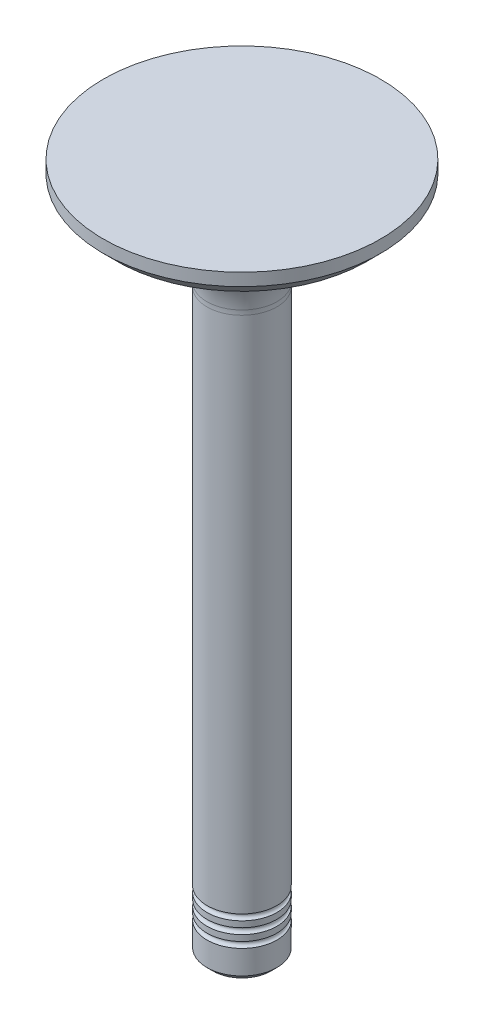
from build123d import *

# Parameters (mm, degrees)
FILLET1_R     = 10
CHAMFER1_SIZE = 1


with BuildPart() as part:
    # Sketch1 → Revolve1 (revolve)
    with BuildSketch(Plane.XY):
        with BuildLine():
            Line((0, 105.721798884), (-23.22, 105.721798884))
            Line((-23.22, 105.721798884), (-23.22, 103.621798884))
            Line((-23.22, 103.621798884), (-20.898, 101.299798884))
            ThreePointArc((-20.898, 101.299798884), (-10.516266258, 97.494211563), (-5.85, 87.469798884))
            Line((-5.85, 87.469798884), (-5.85, -9.678201116))
            Line((-5.85, -9.678201116), (0, -9.678201116))
            Line((0, -9.678201116), (0, 105.721798884))
        make_face()
    revolve(axis=Axis((0, 105.721798884, 0), (0, -1, 0)))

    # Fillet1
    # the kernel refuses this fillet: 10 mm, written as the material it adds along each edge
    with BuildSketch(Plane(origin=(0, 87.469798884, 0), x_dir=(-1, 0, 0), z_dir=(0, 0, 1))) as fillet1_piece_1:
        with BuildLine():
            CenterArc((15.85, 0.281396682), FILLET1_R, 180, 4.511151465)
            Line((5.85, 0.281396682), (5.85, 0))
            ThreePointArc((5.85, 0), (5.86328205, -0.252702678), (5.880979556, -0.505134559))
        make_face()
    revolve(axis=Axis((0, 87.469798884, 0), (0, -1, 0)))

    # Chamfer1
    chamfer1_edges = [part.edges().sort_by_distance(p)[0] for p in [
        (5.85, -9.678201116, 0),
    ]]
    chamfer(chamfer1_edges, length=CHAMFER1_SIZE)

    # Sketch2 → Cut-Revolve1 (revolve, cut)
    with BuildSketch(Plane(origin=(0, 0, 0), x_dir=(0, 0, -1), z_dir=(1, 0, 0)), mode=Mode.PRIVATE) as cut_revolve1_sk:
        with BuildLine():
            Line((-7.85, -1.678201116), (-5.85, -1.678201116))
            ThreePointArc((-5.85, -1.678201116), (-5.35, -2.178201116), (-5.85, -2.678201116))
            Line((-5.85, -2.678201116), (-7.85, -2.678201116))
            Line((-7.85, -2.678201116), (-7.85, -1.678201116))
        make_face()
        with BuildLine():
            Line((-7.85, -4.678201116), (-5.85, -4.678201116))
            ThreePointArc((-5.85, -4.678201116), (-5.35, -4.178201116), (-5.85, -3.678201116))
            Line((-5.85, -3.678201116), (-7.85, -3.678201116))
            Line((-7.85, -3.678201116), (-7.85, -4.678201116))
        make_face()
        with BuildLine():
            Line((-7.85, 0.321798884), (-5.85, 0.321798884))
            ThreePointArc((-5.85, 0.321798884), (-5.35, -0.178201116), (-5.85, -0.678201116))
            Line((-5.85, -0.678201116), (-7.85, -0.678201116))
            Line((-7.85, -0.678201116), (-7.85, 0.321798884))
        make_face()
    revolve(cut_revolve1_sk.sketch.rotate(Axis((0, -8.678201116, 0), (0, 1, 0)), 180), axis=Axis((0, -8.678201116, 0), (0, 1, 0)), mode=Mode.SUBTRACT)


solid = part.part
